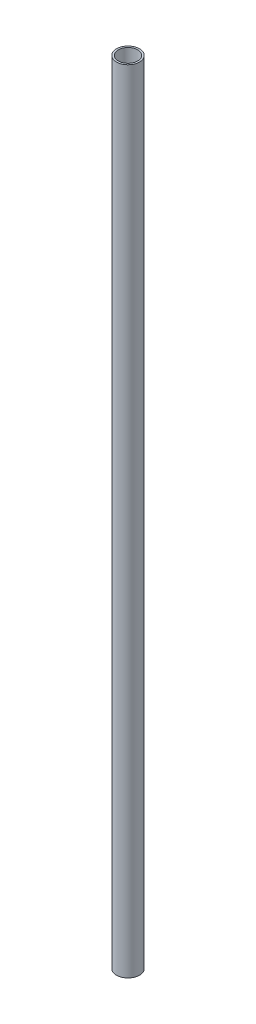
from build123d import *

# Parameters (mm, degrees)
SKETCH1_R           = 7.9375
SKETCH1_R_2         = 6.6929
BOSS_EXTRUDE1_DEPTH = 546.1


with BuildPart() as part:
    # Sketch1 → Boss-Extrude1 (new body)
    with BuildSketch(Plane(origin=(0, 0, 0), x_dir=(1, 0, 0), z_dir=(0, 1, 0))):
        Circle(SKETCH1_R)
        Circle(SKETCH1_R_2, mode=Mode.SUBTRACT)
    extrude(amount=BOSS_EXTRUDE1_DEPTH)


solid = part.part
